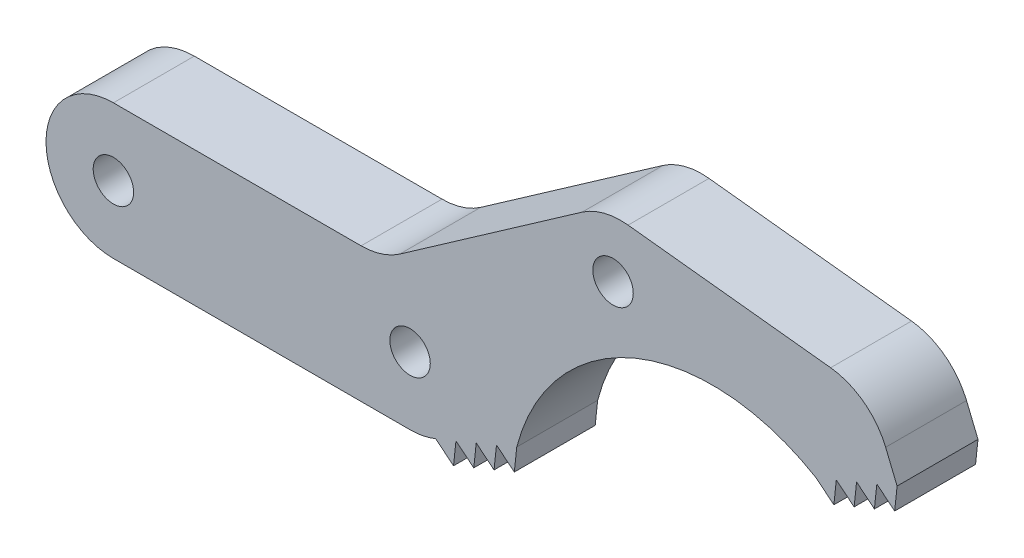
from build123d import *

# Parameters (mm, degrees)
SKETCH1_R           = 1.5
BOSS_EXTRUDE1_DEPTH = 6
FILLET2_R           = 5


with BuildPart() as part:
    # Sketch1 → Boss-Extrude1 (new body)
    with BuildSketch(Plane.XY):
        with BuildLine():
            Line((19.944251464, 5), (0, 5))
            ThreePointArc((0, 5), (-5, 0), (0, -5))
            Line((0, -5), (22, -5))
            ThreePointArc((22, -5), (22.969031552, -4.905199063), (23.901317064, -4.624391141))
            Line((23.901317064, -4.624391141), (25.223175743, -5.70274446))
            Line((25.223175743, -5.70274446), (25.404244184, -4.006463095))
            Line((25.404244184, -4.006463095), (26.726102864, -5.084816415))
            Line((26.726102864, -5.084816415), (26.907171305, -3.388535049))
            Line((26.907171305, -3.388535049), (28.229029985, -4.466888369))
            Line((28.229029985, -4.466888369), (28.410098426, -2.770607004))
            Line((28.410098426, -2.770607004), (29.731957105, -3.848960323))
            Line((29.731957105, -3.848960323), (29.913025547, -2.152678958))
            ThreePointArc((29.913025547, -2.152678958), (38.729983808, 7.959751364), (52.110103023, 6.973642948))
            Line((52.110103023, 6.973642948), (53.431961702, 5.895289628))
            Line((53.431961702, 5.895289628), (53.613030144, 7.591570993))
            Line((53.613030144, 7.591570993), (54.934888823, 6.513217674))
            Line((54.934888823, 6.513217674), (55.115957264, 8.209499039))
            Line((55.115957264, 8.209499039), (56.437815944, 7.13114572))
            Line((56.437815944, 7.13114572), (56.618884385, 8.827427085))
            Line((56.618884385, 8.827427085), (57.940743065, 7.749073765))
            Line((57.940743065, 7.749073765), (58.121811506, 9.44535513))
            Line((58.121811506, 9.44535513), (56.143278706, 14.257550701))
            Line((56.143278706, 14.257550701), (36.302637348, 16.436961709))
            Line((36.302637348, 16.436961709), (19.944251464, 5))
        make_face()
        Circle(SKETCH1_R, mode=Mode.SUBTRACT)
        with Locations((22, 0)):
            Circle(SKETCH1_R, mode=Mode.SUBTRACT)
        with Locations((37.054498685, 12.034873136)):
            Circle(SKETCH1_R, mode=Mode.SUBTRACT)
    extrude(amount=BOSS_EXTRUDE1_DEPTH)

    # Fillet2
    fillet2_edges = [part.edges().sort_by_distance(p)[0] for p in [
        (56.143278706, 14.257550701, 3),
        (36.302637348, 16.436961709, 3),
        (19.944251464, 5, 3),
    ]]
    fillet(fillet2_edges, radius=FILLET2_R)


solid = part.part
